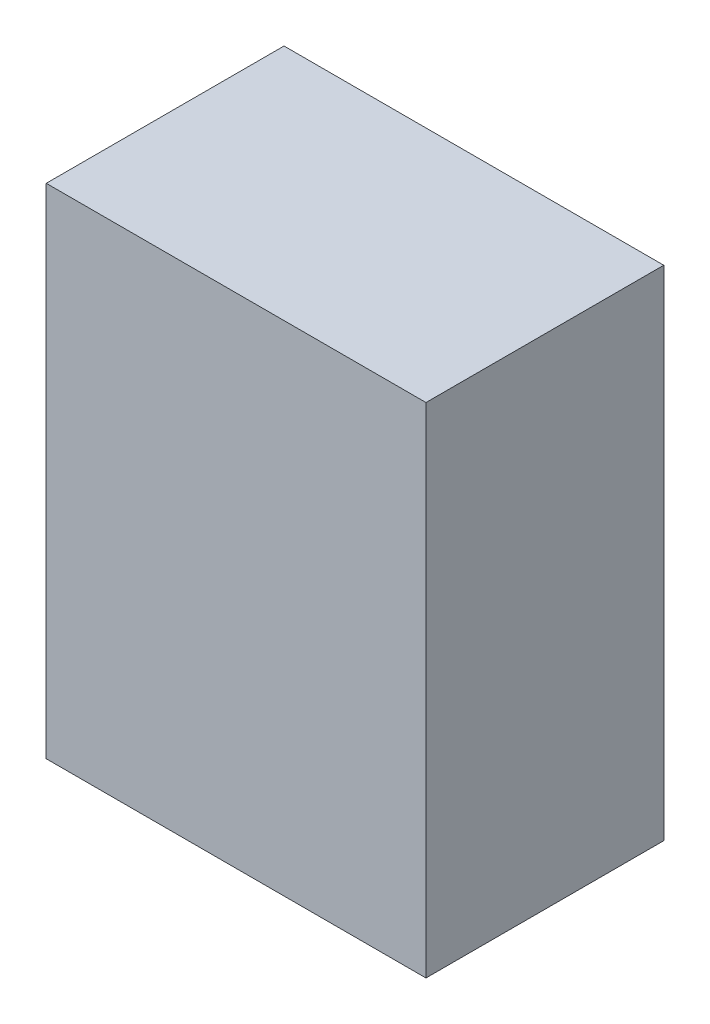
from build123d import *

# Parameters (mm, degrees)
SKETCH1_W             = 400
SKETCH1_H             = 500
BOSS_EXTRUDE1_DEPTH   = 300
CAVITY4_START         = 200.388726282
CAVITY4_OUTLINE_W     = 400
CAVITY4_OUTLINE_H     = 500
CAVITY4_DEPTH         = 99.611273718
CAVITY4_2_OUTLINE_W   = 400
CAVITY4_2_OUTLINE_H   = 500
CAVITY4_2_OUTLINE_W_2 = 320
CAVITY4_2_OUTLINE_H_2 = 420
CAVITY4_2_DEPTH       = 200.388726282


# Read off the part's stored shape, not the designer's step: Cavity4
with BuildPart() as part:
    # Sketch1 → Boss-Extrude1 (new body)
    with BuildSketch(Plane.XY):
        Rectangle(SKETCH1_W, SKETCH1_H)
    extrude(amount=BOSS_EXTRUDE1_DEPTH)

    # Cavity4 outline → Cavity4 (cut)
    with BuildSketch(Plane.XY.offset(CAVITY4_START)):
        Rectangle(CAVITY4_OUTLINE_W, CAVITY4_OUTLINE_H)
    extrude(amount=CAVITY4_DEPTH, mode=Mode.SUBTRACT)

    # Cavity4 2 outline → Cavity4 2 (cut)
    with BuildSketch(Plane.XY):
        Rectangle(CAVITY4_2_OUTLINE_W, CAVITY4_2_OUTLINE_H)
        Rectangle(CAVITY4_2_OUTLINE_W_2, CAVITY4_2_OUTLINE_H_2, mode=Mode.SUBTRACT)
    extrude(amount=CAVITY4_2_DEPTH, mode=Mode.SUBTRACT)


solid = part.part
